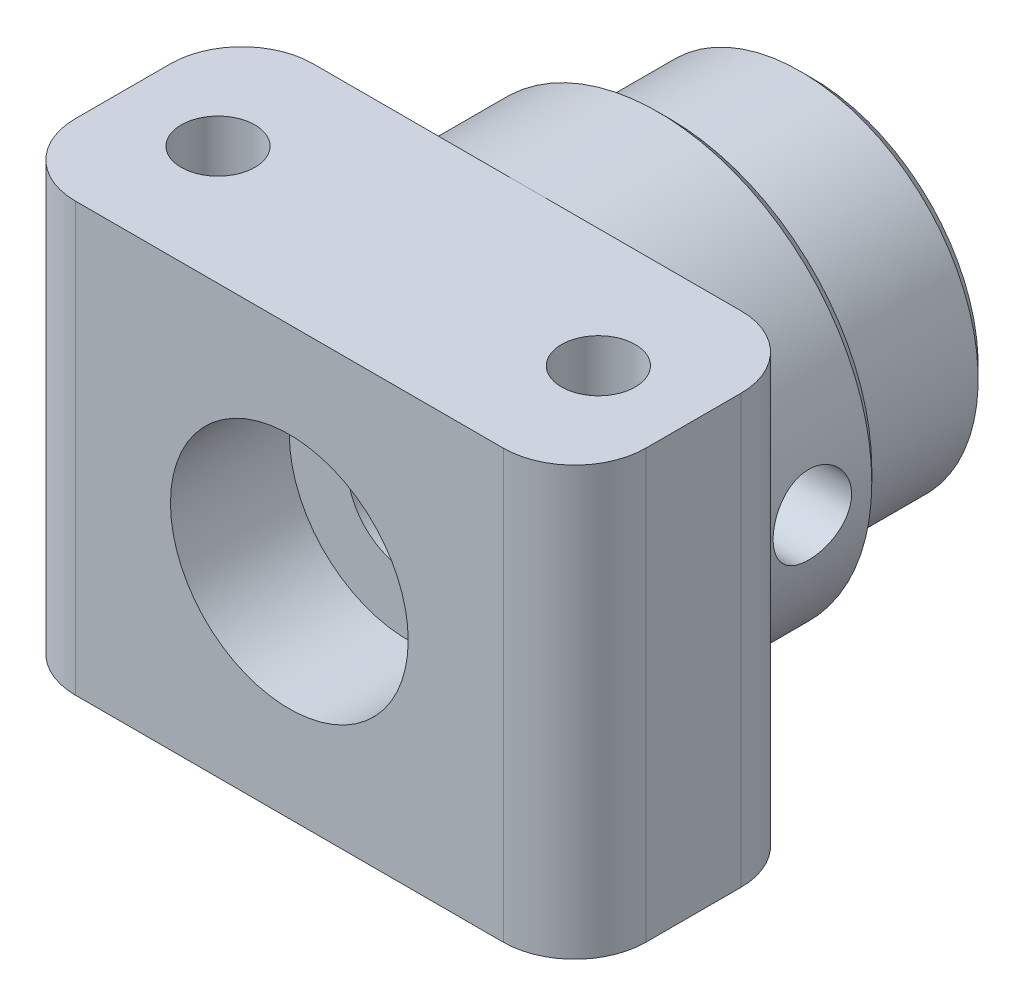
from build123d import *

# Parameters (mm, degrees)
SKETCH_1_W            = 24
SKETCH_1_H            = 18
EXTRUDE_1_DEPTH       = 10
SKETCH_2_R            = 9
SKETCH_2_R_2          = 5.275
EXTRUDE_2_DEPTH       = 6
SKETCH_3_R            = 2.55
CUT_EXTRUDE_1_DEPTH   = 41
SKETCH_4_R            = 1.55
CUT_EXTRUDE_2_DEPTH   = 37.013519789
M4_TAPPED_HOLE1_D     = 3.3
M4_TAPPED_HOLE1_DEPTH = 23.5
M4_TAPPED_HOLE1_TIP   = 0.991420021
SKETCH2_R             = 7.475
SKETCH2_R_2           = 5.275
BOSS_EXTRUDE1_DEPTH   = 6
CHAMFER1_SIZE         = 0.5
SKETCH3_R             = 5
CUT_EXTRUDE1_DEPTH    = 5
FILLET1_R             = 3


with BuildPart() as part:
    # 草图1 → 凸台-拉伸1 (new body)
    with BuildSketch(Plane.XY):
        Rectangle(SKETCH_1_W, SKETCH_1_H)
    extrude(amount=EXTRUDE_1_DEPTH)

    # 草图2 → 凸台-拉伸2 (add)
    with BuildSketch(Plane.XY):
        Circle(SKETCH_2_R)
        Circle(SKETCH_2_R_2, mode=Mode.SUBTRACT)
    extrude(amount=-EXTRUDE_2_DEPTH)

    # 草图3 → 切除-拉伸1 (cut)
    with BuildSketch(Plane(origin=(0, 0, 0), x_dir=(-1, 0, 0), z_dir=(0, 0, -1))):
        Circle(SKETCH_3_R)
    extrude(amount=-CUT_EXTRUDE_1_DEPTH, mode=Mode.SUBTRACT)

    # 草图4 → 切除-拉伸2 (cut)
    with BuildSketch(Plane(origin=(0, 9, 0), x_dir=(1, 0, 0), z_dir=(0, 1, 0))):
        with Locations(Location((-8, -5, 0), (0, 0, 270))):
            Circle(SKETCH_4_R)
        with Locations(Location((8, -5, 0), (0, 0, 270))):
            Circle(SKETCH_4_R)
    extrude(amount=-CUT_EXTRUDE_2_DEPTH, mode=Mode.SUBTRACT)

    # M4 Tapped Hole1
    with Locations(Plane(origin=(9, 0, 0), x_dir=(0, 0, -1), z_dir=(1, 0, 0))):
        with Locations((3, 0)):
            Hole(M4_TAPPED_HOLE1_D / 2, depth=M4_TAPPED_HOLE1_DEPTH)
            with Locations((0, 0, -(M4_TAPPED_HOLE1_DEPTH + M4_TAPPED_HOLE1_TIP / 2))):  # 118° drill point
                Cone(0, M4_TAPPED_HOLE1_D / 2, M4_TAPPED_HOLE1_TIP, mode=Mode.SUBTRACT)

    # Sketch2 → Boss-Extrude1 (add)
    with BuildSketch(Plane(origin=(0, 0, -6), x_dir=(-1, 0, 0), z_dir=(0, 0, -1))):
        Circle(SKETCH2_R)
        with Locations(Location((0, 0, 0), (0, 0, 180))):
            Circle(SKETCH2_R_2, mode=Mode.SUBTRACT)
    extrude(amount=BOSS_EXTRUDE1_DEPTH)

    # Chamfer1
    chamfer1_edges = [part.edges().sort_by_distance(p)[0] for p in [
        (-9, 0, -6),
        (7.475, 0, -12),
    ]]
    chamfer(chamfer1_edges, length=CHAMFER1_SIZE)

    # Sketch3 → Cut-Extrude1 (cut)
    with BuildSketch(Plane.XY.offset(10)):
        Circle(SKETCH3_R)
    extrude(amount=-CUT_EXTRUDE1_DEPTH, mode=Mode.SUBTRACT)

    # Fillet1
    fillet1_edges = [part.edges().sort_by_distance(p)[0] for p in [
        (-12, 0, 10),
        (12, 0, 10),
        (-12, 0, 0),
        (12, 0, 0),
    ]]
    fillet(fillet1_edges, radius=FILLET1_R - 0.0001)  # a hair under: the kernel refuses the full size


solid = part.part
